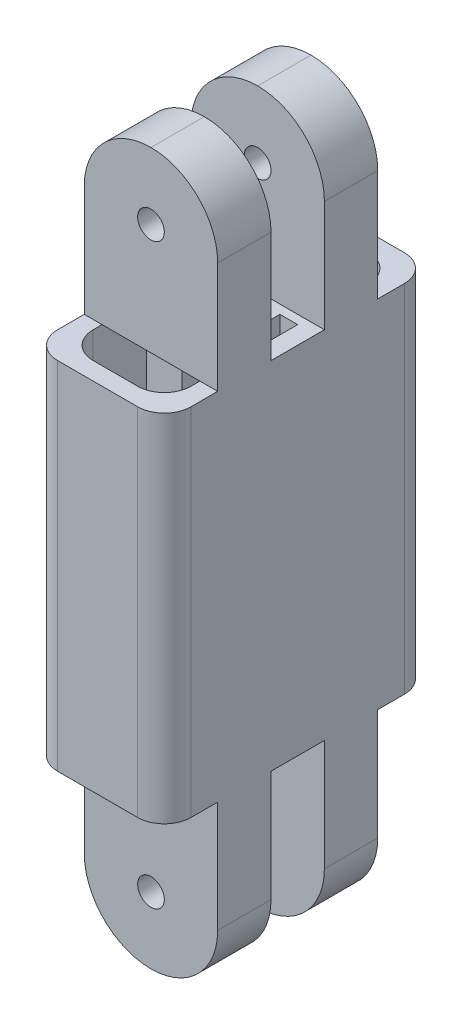
from build123d import *

# Parameters (mm, degrees)
BOSS_EXTRUDE1_START  = -20
SKETCH1_W            = 15
SKETCH1_H            = 30
SKETCH1_W_2          = 2
SKETCH1_H_2          = 4
BOSS_EXTRUDE1_DEPTH  = 40
SKETCH2_W            = 15
SKETCH2_H            = 6
BOSS_EXTRUDE2_DEPTH  = 20
FILLET1_R            = 7.5
SKETCH3_R            = 1.5
CUT_EXTRUDE1_DEPTH   = 48.246693006
FILLET1_OF_MIRROR1_R = 7.5
FILLET2_R            = 3


with BuildPart() as part:
    # Sketch1 → Boss-Extrude1 (new body)
    with BuildSketch(Plane(origin=(0, 0, 0), x_dir=(1, 0, 0), z_dir=(0, 1, 0)).offset(BOSS_EXTRUDE1_START)):
        Rectangle(SKETCH1_W, SKETCH1_H)
        Polygon((-5.5, -13), (5.5, -13), (5.5, -4), (1.5, -4), (1.5, 4), (5.5, 4), (5.5, 13), (-5.5, 13), (-5.5, 4), (-1.5, 4), (-1.5, -4), (-5.5, -4), align=None, mode=Mode.SUBTRACT)
        with Locations((-4.5, 0)):
            Rectangle(SKETCH1_W_2, SKETCH1_H_2, mode=Mode.SUBTRACT)
        with Locations((4.5, 0)):
            Rectangle(SKETCH1_W_2, SKETCH1_H_2, mode=Mode.SUBTRACT)
    extrude(amount=BOSS_EXTRUDE1_DEPTH)

    # Sketch2 → Boss-Extrude2 (add)
    with BuildSketch(Plane.XZ.offset(20)):
        with Locations((0, 6)):
            Rectangle(SKETCH2_W, SKETCH2_H)
        with Locations((0, -6)):
            Rectangle(SKETCH2_W, SKETCH2_H)
    boss_extrude2 = extrude(amount=BOSS_EXTRUDE2_DEPTH)

    # Fillet1
    fillet1_edges = [part.edges().sort_by_distance(p)[0] for p in [
        (7.5, -40, 6),
        (7.5, -40, -6),
        (-7.5, -40, 6),
        (-7.5, -40, -6),
    ]]
    fillet(fillet1_edges, radius=FILLET1_R - 0.0001)  # a hair under: the kernel refuses the full size

    # Sketch3 → Cut-Extrude1 (cut, through all)
    with BuildSketch(Plane.XY.offset(9)):
        with Locations((0, -32.5)):
            Circle(SKETCH3_R)
    cut_extrude1 = extrude(amount=-CUT_EXTRUDE1_DEPTH, mode=Mode.SUBTRACT)

    # Mirror1: Boss-Extrude2, Cut-Extrude1 across plane
    add(boss_extrude2.mirror(Plane.ZX))
    add(cut_extrude1.mirror(Plane.ZX), mode=Mode.SUBTRACT)

    # Fillet1 of Mirror1
    fillet1_of_mirror1_edges = [part.edges().sort_by_distance(p)[0] for p in [
        (7.5, 40, 6),
        (7.5, 40, -6),
        (-7.5, 40, 6),
        (-7.5, 40, -6),
    ]]
    fillet(fillet1_of_mirror1_edges, radius=FILLET1_OF_MIRROR1_R - 0.0001)  # a hair under: the kernel refuses the full size

    # Fillet2
    fillet2_edges = [part.edges().sort_by_distance(p)[0] for p in [
        (5.5, 0, -13),
        (-5.5, 0, -13),
        (-5.5, 0, 13),
        (5.5, 0, 13),
        (7.5, 0, 15),
        (-7.5, 0, 15),
        (-7.5, 0, -15),
        (7.5, 0, -15),
    ]]
    fillet(fillet2_edges, radius=FILLET2_R)


solid = part.part
